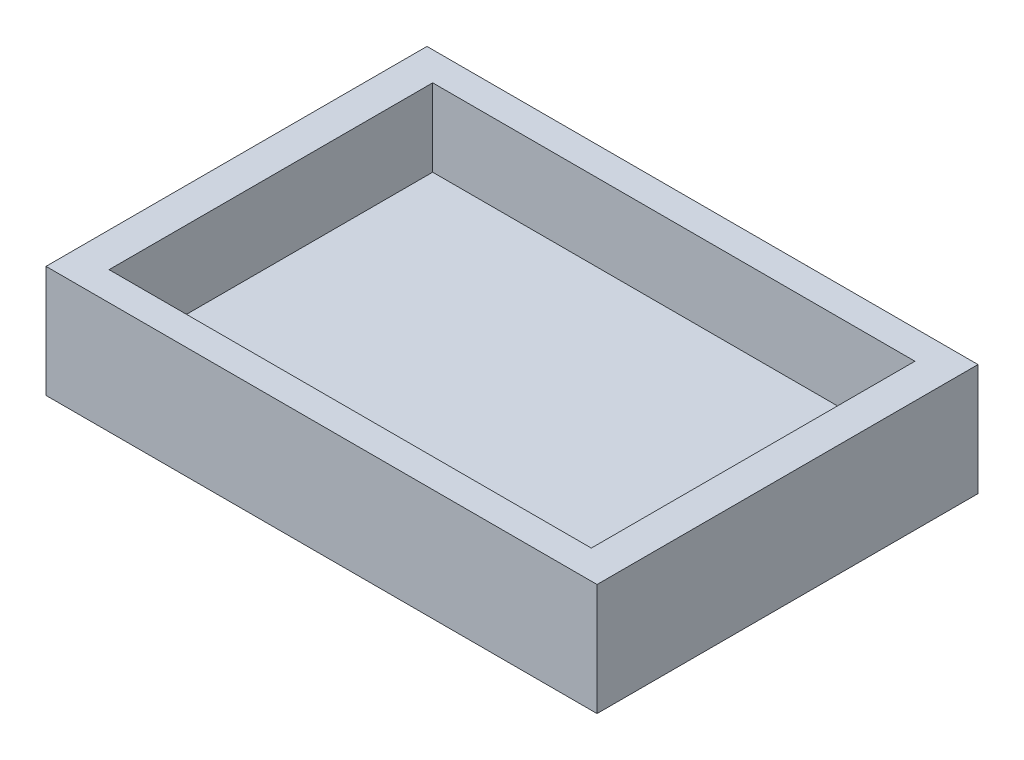
from build123d import *

# Parameters (mm, degrees)
SKETCH1_W           = 97.6
SKETCH1_H           = 66.43745389
BOSS_EXTRUDE1_DEPTH = 6
SKETCH4_W           = 97.6
SKETCH4_H           = 66.43745389
SKETCH4_W_2         = 55
SKETCH4_H_2         = 54
BOSS_EXTRUDE2_DEPTH = 13.5
SKETCH6_W           = 97.6
SKETCH6_H           = 56.43745389
CUT_EXTRUDE2_DEPTH  = 13.5
SKETCH7_W           = 66.43745389
SKETCH7_H           = 19.5
CUT_EXTRUDE3_DEPTH  = 0.75
SKETCH8_W           = 66.43745389
SKETCH8_H           = 19.5
CUT_EXTRUDE4_DEPTH  = 0.75
SKETCH9_W           = 6
SKETCH9_H           = 56.43745389
BOSS_EXTRUDE3_DEPTH = 13.5


with BuildPart() as part:
    # Sketch1 → Boss-Extrude1 (new body)
    with BuildSketch(Plane(origin=(0, 0, 0), x_dir=(1, 0, 0), z_dir=(0, 1, 0))):
        Rectangle(SKETCH1_W, SKETCH1_H)
    extrude(amount=BOSS_EXTRUDE1_DEPTH)

    # Sketch4 → Boss-Extrude2 (add)
    with BuildSketch(Plane(origin=(0, 6, 0), x_dir=(1, 0, 0), z_dir=(0, 1, 0))):
        Rectangle(SKETCH4_W, SKETCH4_H)
        with Locations((3.3, 0)):
            Rectangle(SKETCH4_W_2, SKETCH4_H_2, mode=Mode.SUBTRACT)
    extrude(amount=BOSS_EXTRUDE2_DEPTH)

    # Sketch6 → Cut-Extrude2 (cut)
    with BuildSketch(Plane(origin=(0, 19.5, 0), x_dir=(1, 0, 0), z_dir=(0, 1, 0))):
        Rectangle(SKETCH6_W, SKETCH6_H)
    extrude(amount=-CUT_EXTRUDE2_DEPTH, mode=Mode.SUBTRACT)

    # Sketch7 → Cut-Extrude3 (cut)
    with BuildSketch(Plane(origin=(48.8, 0, 0), x_dir=(0, 0, -1), z_dir=(1, 0, 0))):
        with Locations((0, 9.75)):
            Rectangle(SKETCH7_W, SKETCH7_H)
    extrude(amount=-CUT_EXTRUDE3_DEPTH, mode=Mode.SUBTRACT)

    # Sketch8 → Cut-Extrude4 (cut)
    with BuildSketch(Plane.ZY.offset(48.8)):
        with Locations((0, 9.75)):
            Rectangle(SKETCH8_W, SKETCH8_H)
    extrude(amount=-CUT_EXTRUDE4_DEPTH, mode=Mode.SUBTRACT)

    # Sketch9 → Boss-Extrude3 (add)
    with BuildSketch(Plane(origin=(0, 6, 0), x_dir=(1, 0, 0), z_dir=(0, 1, 0))):
        with Locations((-45.05, 0)):
            Rectangle(SKETCH9_W, SKETCH9_H)
        with Locations((45.05, 0)):
            Rectangle(SKETCH9_W, SKETCH9_H)
    extrude(amount=BOSS_EXTRUDE3_DEPTH)


solid = part.part
